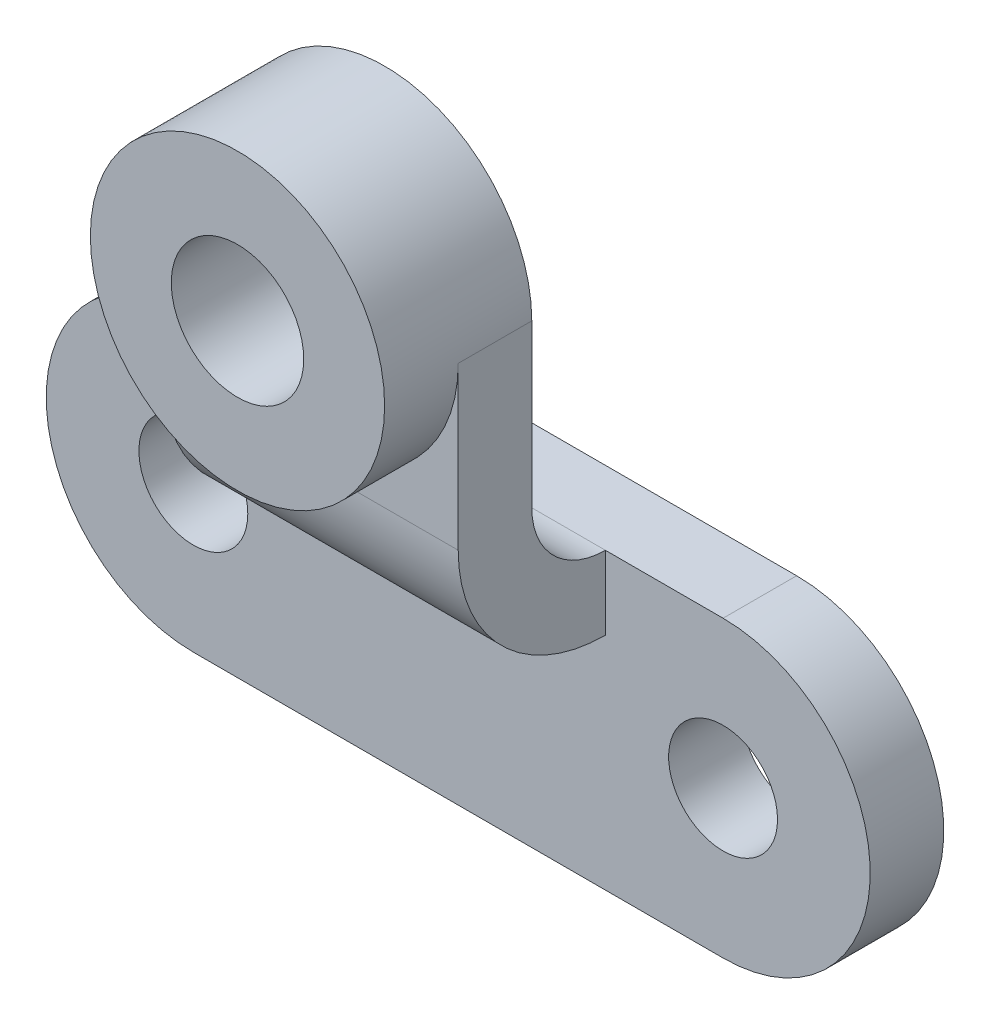
from build123d import *
from build123d.topology import SkipClean

# Parameters (mm, degrees)
SKETCH1_R           = 18.5
BOSS_EXTRUDE1_DEPTH = 25
BOSS_EXTRUDE2_START = 100
SKETCH1_3_R         = 50
SKETCH1_3_R_2       = 22.5
BOSS_EXTRUDE2_DEPTH = 50
BOSS_EXTRUDE3_DEPTH = 50
CUT_EXTRUDE1_DEPTH  = 241.052077683


with BuildPart() as part:
    # Sketch1 → Boss-Extrude1 (new body)
    with BuildSketch(Plane.XY):
        with BuildLine():
            Line((90, 50), (-90, 50))
            ThreePointArc((-90, 50), (-140, 0), (-90, -50))
            Line((-90, -50), (90, -50))
            ThreePointArc((90, -50), (140, 0), (90, 50))
        make_face()
        with Locations((-90, 0)):
            Circle(SKETCH1_R, mode=Mode.SUBTRACT)
        with Locations((90, 0)):
            Circle(SKETCH1_R, mode=Mode.SUBTRACT)
    extrude(amount=BOSS_EXTRUDE1_DEPTH)



with BuildPart() as body_2:
    # Sketch1<3> → Boss-Extrude2 (new body)
    with BuildSketch(Plane.XY.offset(BOSS_EXTRUDE2_START)):
        with Locations((0, 130)):
            Circle(SKETCH1_3_R)
        with Locations((0, 130)):
            Circle(SKETCH1_3_R_2, mode=Mode.SUBTRACT)
    extrude(amount=-BOSS_EXTRUDE2_DEPTH)


with BuildPart() as part_1:
    add(part.part)

    add(body_2.part)  # Boss-Extrude3 merges body 2
    # Sketch2 → Boss-Extrude3 (add, symmetric)
    with BuildSketch(Plane(origin=(0, 0, 0), x_dir=(0, 0, -1), z_dir=(1, 0, 0))):
        with BuildLine():
            Line((-50, 130), (-50, 75))
            ThreePointArc((-50, 75), (-42.67766953, 57.32233047), (-25, 50))
            Line((-25, 50), (-12.5, 50))
            Line((-12.5, 50), (-12.5, 25))
            Line((-12.5, 25), (-25, 25))
            ThreePointArc((-25, 25), (-60.355339059, 39.644660941), (-75, 75))
            Line((-75, 75), (-75, 130))
            Line((-75, 130), (-50, 130))
        make_face()
    extrude(amount=BOSS_EXTRUDE3_DEPTH, both=True)

    # Sketch3 → Cut-Extrude1 (cut, through all)
    with SkipClean():  # the faces are left unmerged after this step: merging them gives an invalid solid
        with BuildSketch(Plane.XY.offset(75)):
            with BuildLine():
                Line((22.5, 130), (-22.5, 130))
                ThreePointArc((-22.5, 130), (0, 107.5), (22.5, 130))
            make_face()
        extrude(amount=-CUT_EXTRUDE1_DEPTH, mode=Mode.SUBTRACT)
    add(part_1.part.scale(1), mode=Mode.REPLACE)  # the faces are merged on a copy


solid = part_1.part
